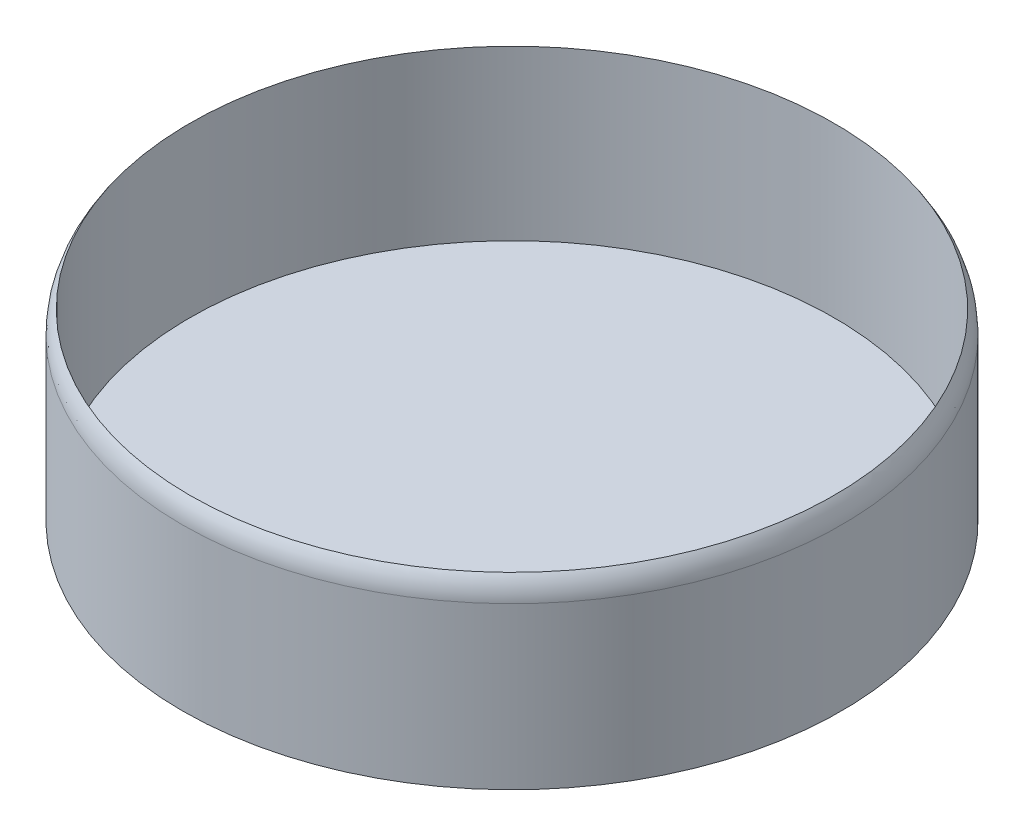
from build123d import *

# Parameters (mm, degrees)
SKETCH2_R           = 90
SKETCH1_R           = 90
SHELL1_T            = -2
CUT_EXTRUDE1_START  = -50
SKETCH4_R           = 90
CUT_EXTRUDE1_DEPTH  = 50
FILLET1_R           = 10
SKETCH5_R           = 88
BOSS_EXTRUDE1_DEPTH = 2


with BuildPart() as part:
    # Sketch2 → Loft1 section 0
    with BuildSketch(Plane(origin=(0, 100, 0), x_dir=(1, 0, 0), z_dir=(0, 1, 0))):
        Circle(SKETCH2_R)
    # Sketch1 → Loft1 section 1
    with BuildSketch(Plane(origin=(0, 0, 0), x_dir=(1, 0, 0), z_dir=(0, 1, 0))):
        Circle(SKETCH1_R)
    loft()

    # Shell1
    shell1_openings = [part.faces().sort_by_distance(p)[0] for p in [
        (0, 100, 0),
    ]]
    offset(amount=SHELL1_T, openings=shell1_openings, kind=Kind.INTERSECTION)

    # Sketch4 → Cut-Extrude1 (cut)
    with BuildSketch(Plane(origin=(0, 100, 0), x_dir=(1, 0, 0), z_dir=(0, 1, 0)).offset(CUT_EXTRUDE1_START)):
        with Locations(Location((0, 0, 0), (0, 0, 270))):
            Circle(SKETCH4_R)
    extrude(amount=CUT_EXTRUDE1_DEPTH, mode=Mode.SUBTRACT)

    # Fillet1
    # the kernel refuses this fillet: 10 mm, written as the material it takes off along each edge
    with BuildSketch(Plane(origin=(0, 50, 0), x_dir=(1, 0, 0), z_dir=(0, 0, -1))) as fillet1_piece_1:
        with BuildLine():
            CenterArc((80, 6), FILLET1_R, 323.130102354, 36.869897646)
            Line((88, 0), (88.16, -0.12))
            ThreePointArc((88.16, -0.12), (89, -0.2), (90, -0.2))
            Line((90, -0.2), (90.2, 0))
            Line((90.2, 0), (90.2, 6))
            Line((90.2, 6), (90, 6))
        make_face()
    revolve(axis=Axis((0, 50, 0), (0, -1, 0)), mode=Mode.SUBTRACT)

    # Sketch5 → Boss-Extrude1 (add)
    with BuildSketch(Plane(origin=(0, 2, 0), x_dir=(1, 0, 0), z_dir=(0, 1, 0))):
        with Locations(Location((0, 0, 0), (0, 0, 270))):
            Circle(SKETCH5_R)
    extrude(amount=BOSS_EXTRUDE1_DEPTH)


solid = part.part
